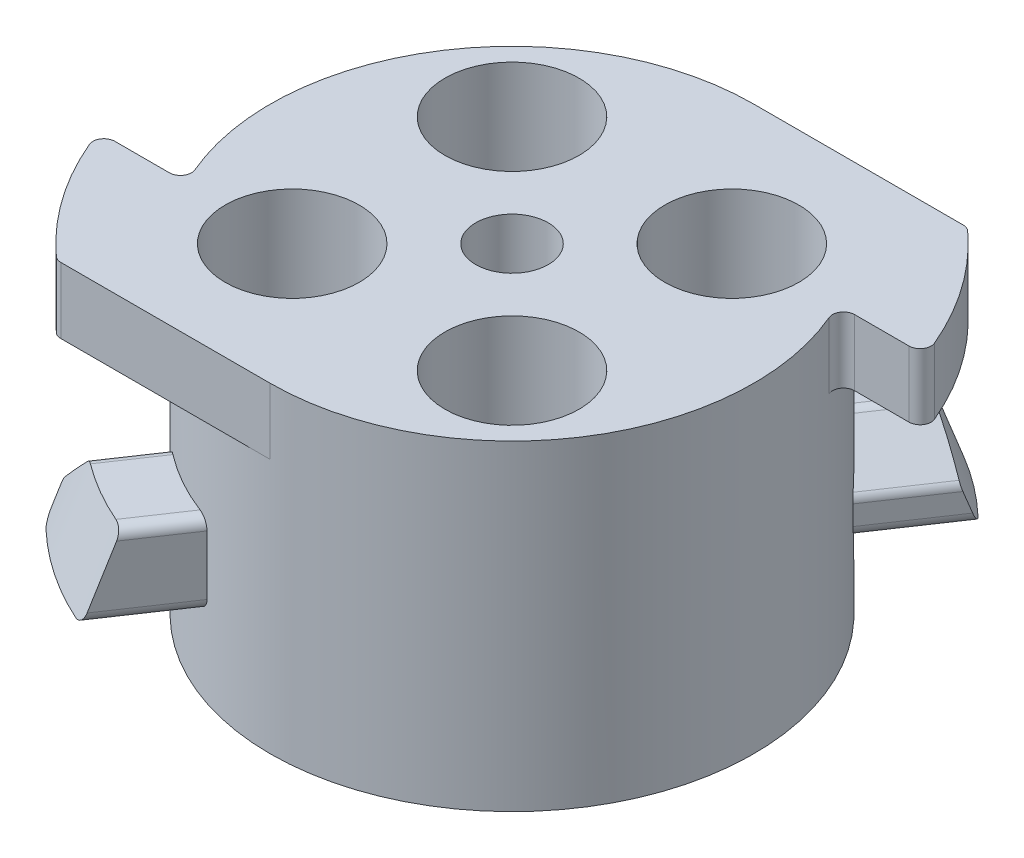
from build123d import *
from build123d.topology import SkipClean

# Parameters (mm, degrees)
SKETCH2_R           = 11
SKETCH2_R_2         = 2.94
SKETCH2_R_3         = 3.05
SKETCH2_R_4         = 1.65
BOSS_EXTRUDE2_DEPTH = 11.6
SKETCH2_10_R        = 3.05
BOSS_EXTRUDE3_DEPTH = 0.4
SKETCH2_13_R        = 2.94
SKETCH2_13_R_2      = 1.65
CUT_EXTRUDE1_DEPTH  = 6
BOSS_EXTRUDE4_DEPTH = 7.3
CUT_EXTRUDE2_DEPTH  = 3.6
CHAMFER1_SIZE       = 2.1
CHAMFER2_SIZE       = 1.4
CHAMFER2_SIZE_2     = 4
SKETCH3_R           = 11
SKETCH3_R_2         = 3.05
SKETCH3_R_3         = 1.65
BOSS_EXTRUDE5_DEPTH = 3
FILLET1_R           = 0.5


with BuildPart() as part:
    # Sketch2 → Boss-Extrude2 (new body)
    # profile 1 of 4: a face of its own
    with BuildSketch(Plane(origin=(0, 0, 0), x_dir=(1, 0, 0), z_dir=(0, 1, 0))):
        with Locations(Location((0, 0, 0), (0, 0, 270))):
            Circle(SKETCH2_R)
        Circle(SKETCH2_R_2, mode=Mode.SUBTRACT)
        with Locations(Location((-5, -5, 0), (0, 0, 270))):
            Circle(SKETCH2_R_3, mode=Mode.SUBTRACT)
        with Locations(Location((5, -5, 0), (0, 0, 270))):
            Circle(SKETCH2_R_3, mode=Mode.SUBTRACT)
        with Locations(Location((5, 5, 0), (0, 0, 270))):
            Circle(SKETCH2_R_3, mode=Mode.SUBTRACT)
        with Locations(Location((-5, 5, 0), (0, 0, 270))):
            Circle(SKETCH2_R_3, mode=Mode.SUBTRACT)
    # profile 2 of 4: a face of its own
    with BuildSketch(Plane(origin=(0, 0, 0), x_dir=(1, 0, 0), z_dir=(0, 1, 0))):
        Circle(SKETCH2_R_2)
        with Locations(Location((0, 0, 0), (0, 0, 270))):
            Circle(SKETCH2_R_4, mode=Mode.SUBTRACT)
    # profile 3 of 4: a face of its own
    with BuildSketch(Plane(origin=(0, 0, 0), x_dir=(1, 0, 0), z_dir=(0, 1, 0))):
        with BuildLine():
            Line((-3.420210086, -10.454767475), (-8.397841265, -7.104664812))
            ThreePointArc((-8.397841265, -7.104664812), (-6.141854882, -9.12565716), (-3.420210086, -10.454767475))
        make_face()
    # profile 4 of 4: a face of its own
    with BuildSketch(Plane(origin=(0, 0, 0), x_dir=(1, 0, 0), z_dir=(0, 1, 0))):
        with BuildLine():
            ThreePointArc((8.397841265, 7.104664812), (6.141854882, 9.12565716), (3.420210086, 10.454767475))
            Line((3.420210086, 10.454767475), (8.397841265, 7.104664812))
        make_face()
    extrude(amount=BOSS_EXTRUDE2_DEPTH)

    # Sketch2<10> → Boss-Extrude3 (add)
    with BuildSketch(Plane(origin=(0, 0, 0), x_dir=(1, 0, 0), z_dir=(0, 1, 0))):
        with Locations(Location((5, 5, 0), (0, 0, 270))):
            Circle(SKETCH2_10_R)
        with Locations(Location((-5, 5, 0), (0, 0, 270))):
            Circle(SKETCH2_10_R)
        with Locations(Location((5, -5, 0), (0, 0, 270))):
            Circle(SKETCH2_10_R)
        with Locations(Location((-5, -5, 0), (0, 0, 270))):
            Circle(SKETCH2_10_R)
    extrude(amount=BOSS_EXTRUDE3_DEPTH)

    # Sketch2<13> → Cut-Extrude1 (cut)
    with BuildSketch(Plane(origin=(0, 0, 0), x_dir=(1, 0, 0), z_dir=(0, 1, 0))):
        with Locations(Location((0, 0, 0), (0, 0, 270))):
            Circle(SKETCH2_13_R)
        with Locations(Location((0, 0, 0), (0, 0, 270))):
            Circle(SKETCH2_13_R_2, mode=Mode.SUBTRACT)
    extrude(amount=CUT_EXTRUDE1_DEPTH, mode=Mode.SUBTRACT)

    # Sketch2<15> → Boss-Extrude4 (add)
    with BuildSketch(Plane(origin=(0, 0, 0), x_dir=(1, 0, 0), z_dir=(0, 1, 0))):
        with BuildLine():
            Line((4.573820951, 12.168819249), (3.420210086, 10.454767475))
            ThreePointArc((3.420210086, 10.454767475), (6.141854882, 9.12565716), (8.397841265, 7.104664812))
            Line((8.397841265, 7.104664812), (9.55145213, 8.818716585))
            ThreePointArc((9.55145213, 8.818716585), (7.25855577, 10.784867553), (4.573820951, 12.168819249))
        make_face()
        with BuildLine():
            Line((5.774205065, 13.952367393), (4.573820951, 12.168819249))
            ThreePointArc((4.573820951, 12.168819249), (7.25855577, 10.784867553), (9.55145213, 8.818716585))
            Line((9.55145213, 8.818716585), (10.751836243, 10.60226473))
            ThreePointArc((10.751836243, 10.60226473), (8.431091702, 12.527038465), (5.774205065, 13.952367393))
        make_face()
        with BuildLine():
            ThreePointArc((-3.420210086, -10.454767475), (-6.141854882, -9.12565716), (-8.397841265, -7.104664812))
            Line((-8.397841265, -7.104664812), (-9.55145213, -8.818716585))
            ThreePointArc((-9.55145213, -8.818716585), (-7.25855577, -10.784867553), (-4.573820951, -12.168819249))
            Line((-4.573820951, -12.168819249), (-3.420210086, -10.454767475))
        make_face()
        with BuildLine():
            ThreePointArc((-4.573820951, -12.168819249), (-7.25855577, -10.784867553), (-9.55145213, -8.818716585))
            Line((-9.55145213, -8.818716585), (-10.751836243, -10.60226473))
            ThreePointArc((-10.751836243, -10.60226473), (-8.431091702, -12.527038465), (-5.774205065, -13.952367393))
            Line((-5.774205065, -13.952367393), (-4.573820951, -12.168819249))
        make_face()
    extrude(amount=BOSS_EXTRUDE4_DEPTH)

    # Sketch2<16> → Cut-Extrude2 (cut)
    with SkipClean():  # the faces are left unmerged after this step: merging them gives an invalid solid
        with BuildSketch(Plane(origin=(0, 0, 0), x_dir=(1, 0, 0), z_dir=(0, 1, 0))):
            with BuildLine():
                Line((5.774205065, 13.952367393), (4.573820951, 12.168819249))
                ThreePointArc((4.573820951, 12.168819249), (7.25855577, 10.784867553), (9.55145213, 8.818716585))
                Line((9.55145213, 8.818716585), (10.751836243, 10.60226473))
                ThreePointArc((10.751836243, 10.60226473), (8.431091702, 12.527038465), (5.774205065, 13.952367393))
            make_face()
            with BuildLine():
                Line((4.573820951, 12.168819249), (3.420210086, 10.454767475))
                ThreePointArc((3.420210086, 10.454767475), (6.141854882, 9.12565716), (8.397841265, 7.104664812))
                Line((8.397841265, 7.104664812), (9.55145213, 8.818716585))
                ThreePointArc((9.55145213, 8.818716585), (7.25855577, 10.784867553), (4.573820951, 12.168819249))
            make_face()
            with BuildLine():
                ThreePointArc((-3.420210086, -10.454767475), (-6.141854882, -9.12565716), (-8.397841265, -7.104664812))
                Line((-8.397841265, -7.104664812), (-9.55145213, -8.818716585))
                ThreePointArc((-9.55145213, -8.818716585), (-7.25855577, -10.784867553), (-4.573820951, -12.168819249))
                Line((-4.573820951, -12.168819249), (-3.420210086, -10.454767475))
            make_face()
            with BuildLine():
                ThreePointArc((-4.573820951, -12.168819249), (-7.25855577, -10.784867553), (-9.55145213, -8.818716585))
                Line((-9.55145213, -8.818716585), (-10.751836243, -10.60226473))
                ThreePointArc((-10.751836243, -10.60226473), (-8.431091702, -12.527038465), (-5.774205065, -13.952367393))
                Line((-5.774205065, -13.952367393), (-4.573820951, -12.168819249))
            make_face()
        extrude(amount=CUT_EXTRUDE2_DEPTH, mode=Mode.SUBTRACT)

    # Chamfer1
    # the kernel refuses this chamfer: 2.1 mm, written as the material it takes off along each edge
    with BuildSketch(Plane(origin=(5.382450555, 7.3, -2.624353515), x_dir=(-0.8292915366777964, 0.027495876610586525, -0.5581393409929051), z_dir=(0.558350443853296, 0, -0.8296051963728455))) as chamfer1_piece_1_section:
        Polygon((CHAMFER1_SIZE * 0.999621916911, -CHAMFER1_SIZE * 0.0274958766106), (-CHAMFER1_SIZE * 0.0274958766106, -CHAMFER1_SIZE * 0.999621916911), (0, 0), align=None)
    chamfer1_piece_1 = extrude(amount=15.017049757, mode=Mode.PRIVATE)
    chamfer1_piece_1 = chamfer1_piece_1 - Plane(origin=(0, 6.59835439, 0), x_dir=(0, 0, 1), z_dir=(0, -1, 0)) * Cylinder(11, 39, mode=Mode.PRIVATE)
    add(chamfer1_piece_1, mode=Mode.SUBTRACT)
    with BuildSketch(Plane(origin=(-5.382450555, 7.3, 2.624353515), x_dir=(-0.022810722114968995, -0.9996219169112966, -0.015352334909656337), z_dir=(-0.5583504438532961, 0, 0.8296051963728455))) as chamfer1_piece_2_section:
        Polygon((CHAMFER1_SIZE * 0.999621916911, CHAMFER1_SIZE * 0.0274958766106), (-CHAMFER1_SIZE * 0.0274958766106, CHAMFER1_SIZE * 0.999621916911), (0, 0), align=None)
    chamfer1_piece_2 = extrude(amount=15.017049757, mode=Mode.PRIVATE)
    chamfer1_piece_2 = chamfer1_piece_2 - Plane(origin=(0, 6.59835439, 0), x_dir=(0, 0, 1), z_dir=(0, -1, 0)) * Cylinder(11, 39, mode=Mode.PRIVATE)
    add(chamfer1_piece_2, mode=Mode.SUBTRACT)

    # Chamfer2
    # the kernel refuses this chamfer: 4, 1.4 mm, written as the material it takes off along each edge
    with BuildSketch(Plane(origin=(0, 7.3, 0), x_dir=(0.9733360776241976, 0, -0.2293836960098559), z_dir=(0.2293836960098559, 0, 0.9733360776241976))) as chamfer2_piece_1:
        Polygon((15.1 - CHAMFER2_SIZE, 0), (15.1, -CHAMFER2_SIZE_2), (15.1, 0), align=None)
    revolve(axis=Axis((0, 7.3, 0), (0, 1, 0)), revolution_arc=93.637337718, mode=Mode.SUBTRACT)
    with BuildSketch(Plane(origin=(0, 7.3, 0), x_dir=(-0.973336077624196, 0, 0.22938369600986216), z_dir=(-0.22938369600986216, 0, -0.973336077624196))) as chamfer2_piece_2:
        Polygon((15.1 - CHAMFER2_SIZE, 0), (15.1, -CHAMFER2_SIZE_2), (15.1, 0), align=None)
    revolve(axis=Axis((0, 7.3, 0), (0, 1, 0)), revolution_arc=93.637337718, mode=Mode.SUBTRACT)

    # Sketch3 → Boss-Extrude5 (add)
    # profile 1 of 3: a face of its own
    with BuildSketch(Plane(origin=(0, 11.6, 0), x_dir=(1, 0, 0), z_dir=(0, 1, 0))):
        with Locations(Location((0, 0, 0), (0, 0, 270))):
            Circle(SKETCH3_R)
        with Locations(Location((5, -5, 0), (0, 0, 270))):
            Circle(SKETCH3_R_2, mode=Mode.SUBTRACT)
        with Locations(Location((-5, 5, 0), (0, 0, 270))):
            Circle(SKETCH3_R_2, mode=Mode.SUBTRACT)
        with Locations(Location((0, 0, 0), (0, 0, 270))):
            Circle(SKETCH3_R_3, mode=Mode.SUBTRACT)
        with Locations(Location((5, 5, 0), (0, 0, 270))):
            Circle(SKETCH3_R_2, mode=Mode.SUBTRACT)
        with Locations(Location((-5, -5, 0), (0, 0, 270))):
            Circle(SKETCH3_R_2, mode=Mode.SUBTRACT)
    # profile 2 of 3: a face of its own
    with BuildSketch(Plane(origin=(0, 11.6, 0), x_dir=(1, 0, 0), z_dir=(0, 1, 0))):
        with BuildLine():
            ThreePointArc((0, 11), (5.744562647, 9.38083152), (9.797958971, 5))
            Line((9.797958971, 5), (13.797958971, 5))
            ThreePointArc((13.797958971, 5), (12.133272038, 8.256354003), (9.715125927, 11))
            Line((9.715125927, 11), (0, 11))
        make_face()
    # profile 3 of 3: a face of its own
    with BuildSketch(Plane(origin=(0, 11.6, 0), x_dir=(1, 0, 0), z_dir=(0, 1, 0))):
        with BuildLine():
            Line((-9.715125927, -11), (0, -11))
            ThreePointArc((0, -11), (-5.744562647, -9.38083152), (-9.797958971, -5))
            Line((-9.797958971, -5), (-13.797958971, -5))
            ThreePointArc((-13.797958971, -5), (-12.133272038, -8.256354003), (-9.715125927, -11))
        make_face()
    extrude(amount=BOSS_EXTRUDE5_DEPTH)

    # Fillet1
    # the kernel refuses this fillet: 0.5 mm, written as the material it adds along each edge
    with BuildSketch(Plane(origin=(9.797958971, 11.6, -5), x_dir=(0.4231826936389881, 0, 0.9060443740813416), z_dir=(0, 1, 0)), Plane(origin=(-9.797958971, 11.6, 5), x_dir=(-0.4231826936389887, 0, -0.9060443740813415), z_dir=(0, 1, 0))) as fillet1_piece_1:
        with BuildLine():
            CenterArc((0.785240184, 0.499695412), FILLET1_R, 154.964312052, 113.035684106)
            Line((0.332217996, 0.711286759), (0, 0))
            ThreePointArc((0, 0), (0.383895201, 0.006700929), (0.767790402, 0))
        make_face()
    extrude(amount=3)
    # the kernel refuses this fillet: 0.5 mm, written as the material it takes off along each edge
    with BuildSketch(Plane(origin=(-7.69990321, 3.6, 6.067658317), x_dir=(0, 1, 0), z_dir=(-0.5583504438532961, 0, 0.8296051963728454))) as fillet1_2_piece_1_section:
        with BuildLine():
            CenterArc((FILLET1_R, -FILLET1_R), FILLET1_R, 90, 90)
            Line((0, -FILLET1_R), (0, 0))
            Line((0, 0), (FILLET1_R, 0))
        make_face()
    fillet1_2_piece_1 = extrude(amount=6.608830073, mode=Mode.PRIVATE)
    fillet1_2_piece_1 = fillet1_2_piece_1 - Plane(origin=(0, 3.713543578, 0), x_dir=(0, 0, 1), z_dir=(0, -1, 0)) * Cylinder(11, 16, mode=Mode.PRIVATE)
    add(fillet1_2_piece_1, mode=Mode.SUBTRACT)
    with BuildSketch(Plane(origin=(-2.722272031, 3.6, 9.41776098), x_dir=(0, 1, 0), z_dir=(-0.5583504438533483, 0, 0.8296051963728102))) as fillet1_2_piece_2_section:
        with BuildLine():
            CenterArc((FILLET1_R, FILLET1_R), FILLET1_R, 180, 90)
            Line((0, FILLET1_R), (0, 0))
            Line((0, 0), (FILLET1_R, 0))
        make_face()
    fillet1_2_piece_2 = extrude(amount=6.608830073, mode=Mode.PRIVATE)
    fillet1_2_piece_2 = fillet1_2_piece_2 - Plane(origin=(0, 3.713543549, 0), x_dir=(0, 0, 1), z_dir=(0, -1, 0)) * Cylinder(11, 16, mode=Mode.PRIVATE)
    add(fillet1_2_piece_2, mode=Mode.SUBTRACT)
    with BuildSketch(Plane(origin=(-2.722272031, 7.3, 9.41776098), x_dir=(0, -1, 0), z_dir=(-0.5583504438533483, 0, 0.8296051963728102))) as fillet1_2_piece_3_section:
        with BuildLine():
            CenterArc((FILLET1_R, -FILLET1_R), FILLET1_R, 90, 90)
            Line((0, -FILLET1_R), (0, 0))
            Line((0, 0), (FILLET1_R, 0))
        make_face()
    fillet1_2_piece_3 = extrude(amount=5.284492652, mode=Mode.PRIVATE)
    fillet1_2_piece_3 = fillet1_2_piece_3 - Plane(origin=(0, 7.186341998, 0), x_dir=(0, 0, 1), z_dir=(0, -1, 0)) * Cylinder(11, 13, mode=Mode.PRIVATE)
    add(fillet1_2_piece_3, mode=Mode.SUBTRACT)
    with BuildSketch(Plane(origin=(-6.578812183, 7.3, 8.163003761), x_dir=(0.8296051963730308, 0, 0.5583504438530207), z_dir=(-0.5583504438530207, 0, 0.8296051963730307))) as fillet1_2_piece_4_section:
        with BuildLine():
            CenterArc((FILLET1_R * 0.414213562373, -FILLET1_R), FILLET1_R, 90, 45)
            Line((-FILLET1_R * 0.292893218813, -FILLET1_R * 0.292893218813), (0, 0))
            Line((0, 0), (FILLET1_R * 0.414213562373, 0))
        make_face()
    fillet1_2_piece_4 = extrude(amount=3.742819905, mode=Mode.PRIVATE)
    fillet1_2_piece_4 = fillet1_2_piece_4 - Plane(origin=(0, 7.269029723, 0), x_dir=(0, 0, 1), z_dir=(0, -1, 0)) * Cylinder(11, 9, mode=Mode.PRIVATE)
    add(fillet1_2_piece_4, mode=Mode.SUBTRACT)
    with BuildSketch(Plane(origin=(-8.108745857, 5.2, 6.675122658), x_dir=(0, -1, 0), z_dir=(-0.5583504438530207, 0, 0.8296051963730307))) as fillet1_2_piece_5_section:
        with BuildLine():
            CenterArc((FILLET1_R * 0.414213562373, FILLET1_R), FILLET1_R, 225, 45)
            Line((-FILLET1_R * 0.292893218813, FILLET1_R * 0.292893218814), (0, 0))
            Line((0, 0), (FILLET1_R * 0.414213562373, 0))
        make_face()
    fillet1_2_piece_5 = extrude(amount=4.57234541, mode=Mode.PRIVATE)
    fillet1_2_piece_5 = fillet1_2_piece_5 - Plane(origin=(0, 5.187022636, 0), x_dir=(0, 0, 1), z_dir=(0, -1, 0)) * Cylinder(11, 10, mode=Mode.PRIVATE)
    add(fillet1_2_piece_5, mode=Mode.SUBTRACT)
    with BuildSketch(Plane(origin=(6.412315236, 3.6, -14.900480751), x_dir=(0, 1, 0), z_dir=(-0.5583504438533491, 0, 0.8296051963728097))) as fillet1_2_piece_6_section:
        with BuildLine():
            CenterArc((FILLET1_R, -FILLET1_R), FILLET1_R, 90, 90)
            Line((0, -FILLET1_R), (0, 0))
            Line((0, 0), (FILLET1_R, 0))
        make_face()
    fillet1_2_piece_6 = extrude(amount=6.608830073, mode=Mode.PRIVATE)
    fillet1_2_piece_6 = fillet1_2_piece_6 - Plane(origin=(0, 3.713543535, 0), x_dir=(0, 0, 1), z_dir=(0, -1, 0)) * Cylinder(11, 16, mode=Mode.PRIVATE)
    add(fillet1_2_piece_6, mode=Mode.SUBTRACT)
    with BuildSketch(Plane(origin=(2.722272031, 7.3, -9.41776098), x_dir=(0, -1, 0), z_dir=(0.5583504438533491, 0, -0.8296051963728097))) as fillet1_2_piece_7_section:
        with BuildLine():
            CenterArc((FILLET1_R, -FILLET1_R), FILLET1_R, 90, 90)
            Line((0, -FILLET1_R), (0, 0))
            Line((0, 0), (FILLET1_R, 0))
        make_face()
    fillet1_2_piece_7 = extrude(amount=5.284492652, mode=Mode.PRIVATE)
    fillet1_2_piece_7 = fillet1_2_piece_7 - Plane(origin=(0, 7.18634201, 0), x_dir=(0, 0, 1), z_dir=(0, -1, 0)) * Cylinder(11, 13, mode=Mode.PRIVATE)
    add(fillet1_2_piece_7, mode=Mode.SUBTRACT)
    with BuildSketch(Plane(origin=(11.389946415, 3.6, -11.550378088), x_dir=(0, 1, 0), z_dir=(-0.558350443853296, 0, 0.8296051963728455))) as fillet1_2_piece_8_section:
        with BuildLine():
            CenterArc((FILLET1_R, FILLET1_R), FILLET1_R, 180, 90)
            Line((0, FILLET1_R), (0, 0))
            Line((0, 0), (FILLET1_R, 0))
        make_face()
    fillet1_2_piece_8 = extrude(amount=6.608830073, mode=Mode.PRIVATE)
    fillet1_2_piece_8 = fillet1_2_piece_8 - Plane(origin=(0, 3.713543574, 0), x_dir=(0, 0, 1), z_dir=(0, -1, 0)) * Cylinder(11, 16, mode=Mode.PRIVATE)
    add(fillet1_2_piece_8, mode=Mode.SUBTRACT)
    with BuildSketch(Plane(origin=(6.578812183, 7.3, -8.163003761), x_dir=(-0.8296051963730308, 0, -0.5583504438530207), z_dir=(0.5583504438530207, 0, -0.8296051963730307))) as fillet1_2_piece_9_section:
        with BuildLine():
            CenterArc((FILLET1_R * 0.414213562373, -FILLET1_R), FILLET1_R, 90, 45)
            Line((-FILLET1_R * 0.292893218814, -FILLET1_R * 0.292893218814), (0, 0))
            Line((0, 0), (FILLET1_R * 0.414213562373, 0))
        make_face()
    fillet1_2_piece_9 = extrude(amount=3.742819905, mode=Mode.PRIVATE)
    fillet1_2_piece_9 = fillet1_2_piece_9 - Plane(origin=(0, 7.269029723, 0), x_dir=(0, 0, 1), z_dir=(0, -1, 0)) * Cylinder(11, 9, mode=Mode.PRIVATE)
    add(fillet1_2_piece_9, mode=Mode.SUBTRACT)
    with BuildSketch(Plane(origin=(8.108745857, 5.2, -6.675122658), x_dir=(0, -1, 0), z_dir=(0.5583504438530207, 0, -0.8296051963730307))) as fillet1_2_piece_10_section:
        with BuildLine():
            CenterArc((FILLET1_R * 0.414213562373, FILLET1_R), FILLET1_R, 225, 45)
            Line((-FILLET1_R * 0.292893218813, FILLET1_R * 0.292893218813), (0, 0))
            Line((0, 0), (FILLET1_R * 0.414213562373, 0))
        make_face()
    fillet1_2_piece_10 = extrude(amount=4.57234541, mode=Mode.PRIVATE)
    fillet1_2_piece_10 = fillet1_2_piece_10 - Plane(origin=(0, 5.187022636, 0), x_dir=(0, 0, 1), z_dir=(0, -1, 0)) * Cylinder(11, 10, mode=Mode.PRIVATE)
    add(fillet1_2_piece_10, mode=Mode.SUBTRACT)
    with BuildSketch(Plane(origin=(13.797958971, 9.736880684, -5), x_dir=(-0.3644546021644692, 0, -0.9312211568478985), z_dir=(0, 1, 0)), Plane(origin=(-13.797958971, 9.736880684, 5), x_dir=(0.3644546021644716, 0, 0.9312211568478976), z_dir=(0, 1, 0))) as fillet1_2_piece_11:
        with BuildLine():
            CenterArc((0.73255268, 0.49983881), FILLET1_R, 158.625978152, 112.828923313)
            Line((0.266942102, 0.682066111), (0, 0))
            ThreePointArc((0, 0), (0.372623863, -0.00473124), (0.745247727, 0))
        make_face()
    extrude(amount=6.726238633, mode=Mode.SUBTRACT)
    with BuildSketch(Plane(origin=(9.715125927, 11.113983968, -11), x_dir=(-1, 0, 0), z_dir=(0, 1, 0)), Plane(origin=(-9.715125927, 11.113983968, 11), x_dir=(1, 0, 0), z_dir=(0, 1, 0))) as fillet1_2_piece_12:
        with BuildLine():
            CenterArc((0.191066067, 0.5), FILLET1_R, 227.790295209, 42.209704791)
            ThreePointArc((-0.144856962, 0.129654595), (-0.072643168, 0.064587437), (0, 0))
            Line((0, 0), (0.191066067, 0))
        make_face()
    extrude(amount=3.972032065, mode=Mode.SUBTRACT)


solid = part.part
